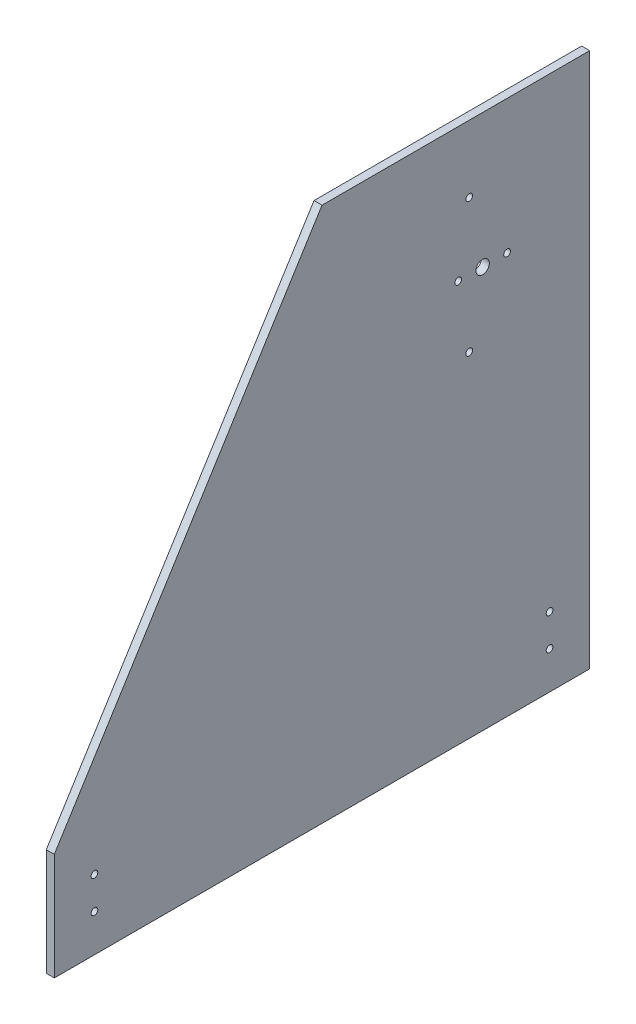
from build123d import *

# Parameters (mm, degrees)
SKETCH1_R           = 2.5
SKETCH1_R_2         = 5
BOSS_EXTRUDE1_DEPTH = 6


with BuildPart() as part:
    # Sketch1 → Boss-Extrude1 (new body)
    with BuildSketch(Plane(origin=(0, 0, 0), x_dir=(0, 0, -1), z_dir=(1, 0, 0))):
        Polygon((0, 0), (400, 0), (400, 400), (200, 400), (0, 80), align=None)
        with Locations((30, 52)):
            Circle(SKETCH1_R, mode=Mode.SUBTRACT)
        with Locations((30, 28)):
            Circle(SKETCH1_R, mode=Mode.SUBTRACT)
        with Locations((370, 28)):
            Circle(SKETCH1_R, mode=Mode.SUBTRACT)
        with Locations((370, 52)):
            Circle(SKETCH1_R, mode=Mode.SUBTRACT)
        with Locations((310, 350)):
            Circle(SKETCH1_R, mode=Mode.SUBTRACT)
        with Locations((310, 250)):
            Circle(SKETCH1_R, mode=Mode.SUBTRACT)
        with Locations((320, 300)):
            Circle(SKETCH1_R_2, mode=Mode.SUBTRACT)
        with Locations((338.25, 300)):
            Circle(SKETCH1_R, mode=Mode.SUBTRACT)
        with Locations((301.75, 300)):
            Circle(SKETCH1_R, mode=Mode.SUBTRACT)
    extrude(amount=BOSS_EXTRUDE1_DEPTH)


solid = part.part
